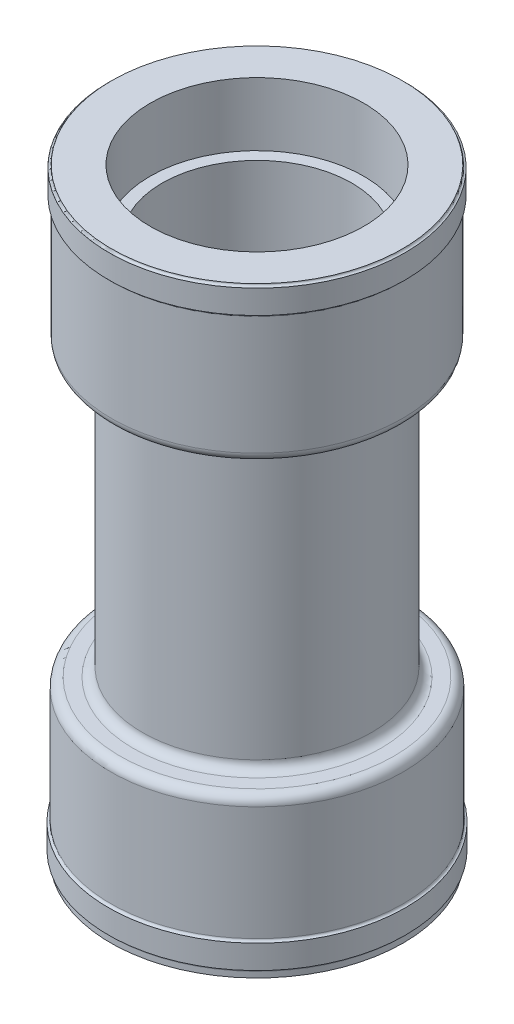
from build123d import *

# Parameters (mm, degrees)
FILLET6_R = 1
FILLET7_R = 4


with BuildPart() as part:
    # Sketch1 → Revolve2 (revolve)
    with BuildSketch(Plane.XY, mode=Mode.PRIVATE) as revolve2_sk:
        Polygon((2.501527055, -105.537304088), (-11.313925207, -105.537304088), (-11.313925207, -39.627766165), (-11.313925207, 19.895392168), (2.210684424, 19.895392168), (2.210684424, 76.628531783), (3.214786306, 76.628531783), (3.214786306, 86.972233835), (2.194593265, 86.972233835), (2.194593265, 87.972233835), (-14.713925207, 87.972233835), (-14.713925207, 60.372233835), (-19.913925207, 60.372233835), (-19.913925207, -39.627771733), (-19.913925207, -139.627771733), (-14.716750826, -139.627771733), (-14.716750826, -174.174326464), (2.510180583, -174.174326464), (2.510180583, -170.671507731), (3.505957364, -170.671507731), (3.505957364, -160.321084419), (2.501527055, -160.321084419), align=None)
    revolve(revolve2_sk.sketch.rotate(Axis((-61.313925207, 87.972233835, 0), (0, -1, 0)), 180), axis=Axis((-61.313925207, 87.972233835, 0), (0, -1, 0)))

    # Fillet6
    # the kernel refuses this fillet: 1 mm, written as the material it adds along each edge
    with BuildSketch(Plane(origin=(-61.313925207, -160.321084419, 0), x_dir=(-1, 0, 0), z_dir=(0, 0, 1))) as fillet6_piece_1:
        with BuildLine():
            CenterArc((63.815452262 + FILLET6_R, -FILLET6_R), FILLET6_R, 90, 90)
            Line((63.815452262, -FILLET6_R), (63.815452262, 0))
            Line((63.815452262, 0), (63.815452262 + FILLET6_R, 0))
        make_face()
    revolve(axis=Axis((-61.313925207, -160.321084419, 0), (0, -1, 0)))
    with BuildSketch(Plane(origin=(-61.313925207, -170.671507731, 0), x_dir=(-1, 0, 0), z_dir=(0, 0, 1))) as fillet6_piece_2_section:
        with BuildLine():
            CenterArc((63.824105789 + FILLET6_R, FILLET6_R), FILLET6_R, 180, 90)
            Line((63.824105789 + FILLET6_R, 0), (63.824105789, 0))
            Line((63.824105789, 0), (63.824105789, FILLET6_R))
        make_face()
    fillet6_piece_2 = revolve(axis=Axis((-61.313925207, -170.671507731, 0), (0, -1, 0)), mode=Mode.PRIVATE)
    fillet6_piece_2 = fillet6_piece_2 & Plane(origin=(-61.313925207, -170.932863829, 0), x_dir=(-1, 0, 0), z_dir=(0, 1, 0)) * Cylinder(64.819882571, 260, mode=Mode.PRIVATE)
    add(fillet6_piece_2)
    with BuildSketch(Plane(origin=(-61.313925207, 86.972233835, 0), x_dir=(-1, 0, 0), z_dir=(0, 0, 1))) as fillet6_piece_3:
        with BuildLine():
            CenterArc((63.508518472 + FILLET6_R, -FILLET6_R), FILLET6_R, 90, 90)
            Line((63.508518472, -FILLET6_R), (63.508518472, 0))
            Line((63.508518472, 0), (63.508518472 + FILLET6_R, 0))
        make_face()
    revolve(axis=Axis((-61.313925207, 86.972233835, 0), (0, -1, 0)))
    with BuildSketch(Plane(origin=(-61.313925207, 76.628531783, 0), x_dir=(-1, 0, 0), z_dir=(0, 0, 1))) as fillet6_piece_4:
        with BuildLine():
            CenterArc((63.52460963 + FILLET6_R, FILLET6_R), FILLET6_R, 180, 90)
            Line((63.52460963 + FILLET6_R, 0), (63.52460963, 0))
            Line((63.52460963, 0), (63.52460963, FILLET6_R))
        make_face()
    revolve(axis=Axis((-61.313925207, 76.628531783, 0), (0, -1, 0)))

    # Fillet7
    fillet7_edges = [part.edges().sort_by_distance(p)[0] for p in [
        (2.501527055, -105.537304088, 0),
        (2.210684424, 19.895392168, 0),
        (-11.313925207, 19.895392168, 0),
        (-11.313925207, -105.537304088, 0),
    ]]
    fillet(fillet7_edges, radius=FILLET7_R)


solid = part.part
